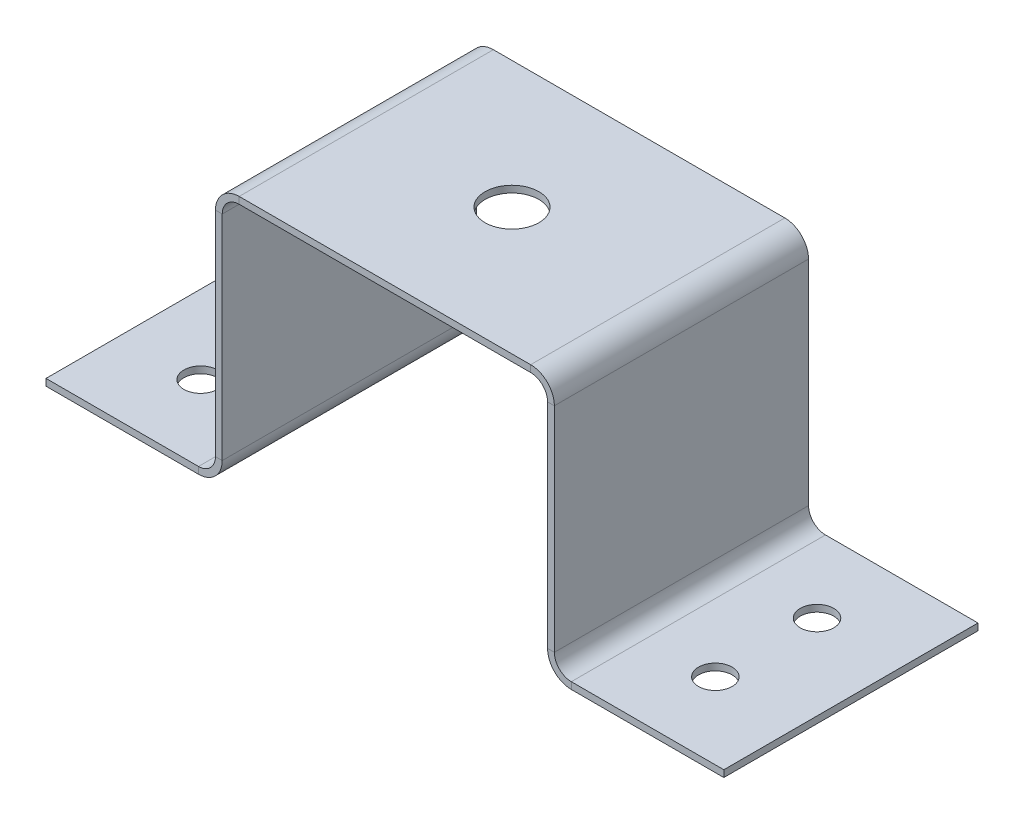
from build123d import *

# Parameters (mm, degrees)
BASE_FLANGE1_DEPTH      = 15
BASE_FLANGE1_DEPTH_BACK = 15
SKETCH6_R               = 3.175
CUT_EXTRUDE1_DEPTH      = 53.665358634
SKETCH7_R               = 1.984375
CUT_EXTRUDE2_DEPTH      = 10


# Sheet-metal steps are written as plain solids
with BuildPart() as part:
    # Sketch1 → Base-Flange1 (new, two sides: drawn at the far end of the back side and taken through both)
    with BuildSketch(Plane.XY.offset(-BASE_FLANGE1_DEPTH_BACK)):
        with BuildLine():
            Line((-40, 0), (-22, 0))
            ThreePointArc((-22, 0), (-20.585786438, 0.585786438), (-20, 2))
            Line((-20, 2), (-20, 27.2))
            ThreePointArc((-20, 27.2), (-19.179898987, 29.179898987), (-17.2, 30))
            Line((-17.2, 30), (17.2, 30))
            ThreePointArc((17.2, 30), (19.179898987, 29.179898987), (20, 27.2))
            Line((20, 27.2), (20, 2))
            ThreePointArc((20, 2), (20.585786438, 0.585786438), (22, 0))
            Line((22, 0), (40, 0))
            Line((40, 0), (40, -0.8))
            Line((40, -0.8), (22, -0.8))
            ThreePointArc((22, -0.8), (20.020101013, 0.020101013), (19.2, 2))
            Line((19.2, 2), (19.2, 27.2))
            ThreePointArc((19.2, 27.2), (18.614213562, 28.614213562), (17.2, 29.2))
            Line((17.2, 29.2), (-17.2, 29.2))
            ThreePointArc((-17.2, 29.2), (-18.614213562, 28.614213562), (-19.2, 27.2))
            Line((-19.2, 27.2), (-19.2, 2))
            ThreePointArc((-19.2, 2), (-20.020101013, 0.020101013), (-22, -0.8))
            Line((-22, -0.8), (-40, -0.8))
            Line((-40, -0.8), (-40, 0))
        make_face()
    extrude(amount=BASE_FLANGE1_DEPTH + BASE_FLANGE1_DEPTH_BACK)

    # Sketch6 → Cut-Extrude1 (cut, through all)
    with BuildSketch(Plane(origin=(0, 30, 0), x_dir=(1, 0, 0), z_dir=(0, 1, 0))):
        with Locations(Location((0, 0, 0), (0, 0, 270))):
            Circle(SKETCH6_R)
    extrude(amount=-CUT_EXTRUDE1_DEPTH, mode=Mode.SUBTRACT)

    # Sketch7 → Cut-Extrude2 (cut)
    with BuildSketch(Plane(origin=(0, 0, 0), x_dir=(1, 0, 0), z_dir=(0, 1, 0))):
        with Locations(Location((30, -6, 0), (0, 0, 180))):
            Circle(SKETCH7_R)
        with Locations(Location((30, 6, 0), (0, 0, 180))):
            Circle(SKETCH7_R)
        with Locations(Location((-30.742868113, 6, 0), (0, 0, 180))):
            Circle(SKETCH7_R)
        with Locations(Location((-30.742868113, -6, 0), (0, 0, 180))):
            Circle(SKETCH7_R)
    extrude(amount=-CUT_EXTRUDE2_DEPTH, mode=Mode.SUBTRACT)


solid = part.part
